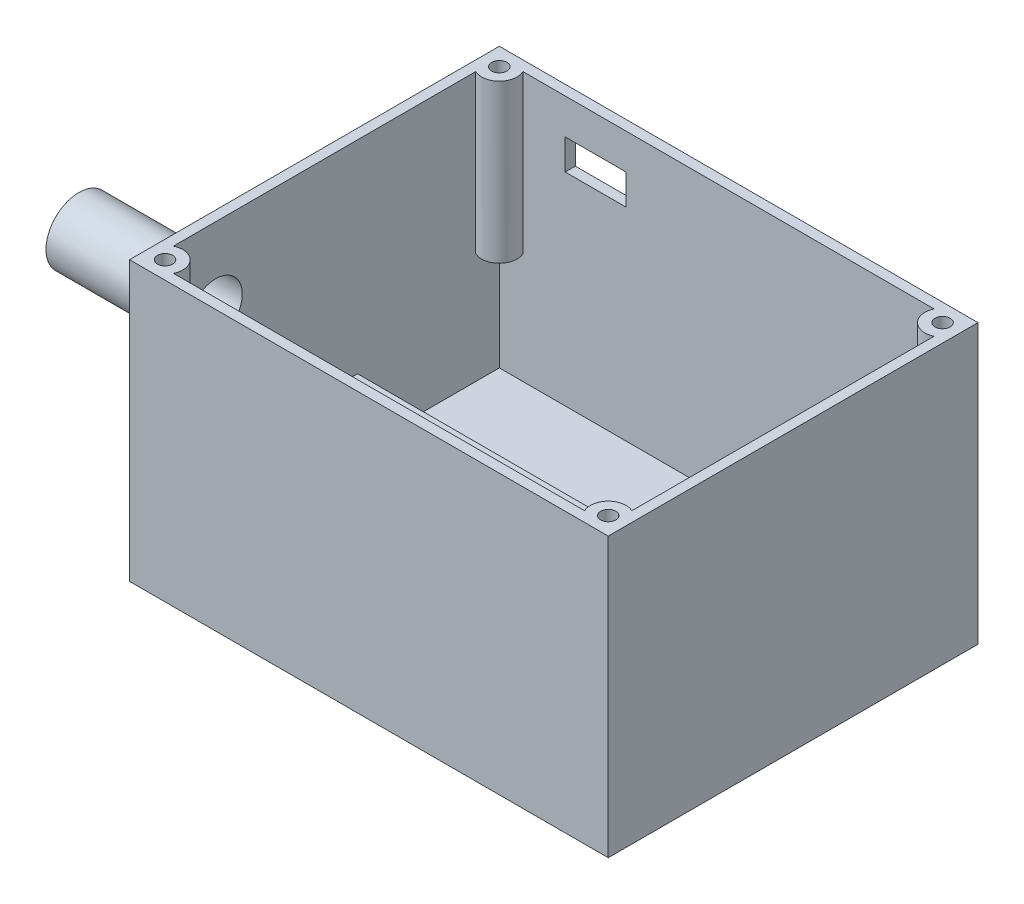
from build123d import *

# Parameters (mm, degrees)
SKETCH1_W                 = 94.5
SKETCH1_H                 = 73
BOSS_EXTRUDE1_DEPTH       = 55
F_3_0MM_DOWEL_HOLE1_D     = 3
F_3_0MM_DOWEL_HOLE1_DEPTH = 30
F_3_0MM_DOWEL_HOLE1_TIP   = 0.901290929
SKETCH7_W                 = 60
SKETCH7_H                 = 31
CUT_EXTRUDE2_DEPTH        = 20
SHELL2_START              = 2
SHELL2_DEPTH              = 53
SHELL2_START_2            = 22
SHELL2_2_OUTLINE_W        = 64
SHELL2_2_OUTLINE_H        = 34
SHELL2_2_DEPTH            = 33
SHELL2_3_DEPTH            = 21.868454444
CUT_EXTRUDE3_DEPTH        = 1.5
F_3_0MM_DOWEL_HOLE3_D     = 3
SKETCH15_R                = 3.5
CUT_EXTRUDE4_DEPTH        = 3
SKETCH20_W                = 78.95760637
SKETCH20_H                = 8
BOSS_EXTRUDE2_DEPTH       = 10
SKETCH21_W                = 6
SKETCH21_H                = 6
BOSS_EXTRUDE3_DEPTH       = 30
F_3_0MM_DOWEL_HOLE5_D     = 3
F_3_0MM_DOWEL_HOLE5_DEPTH = 10
F_3_0MM_DOWEL_HOLE5_TIP   = 0.901290929
F_3_0MM_DOWEL_HOLE6_D     = 3
F_3_0MM_DOWEL_HOLE6_DEPTH = 10
F_3_0MM_DOWEL_HOLE6_TIP   = 0.901290929
SKETCH27_W                = 12
SKETCH27_H                = 6
CUT_EXTRUDE5_DEPTH        = 30
SKETCH28_R                = 6.5
BOSS_EXTRUDE4_DEPTH       = 25
FILLET1_R                 = 6
SKETCH29_R                = 5.25
CUT_EXTRUDE6_DEPTH        = 29


with BuildPart() as part:
    # Sketch1 → Boss-Extrude1 (new body)
    with BuildSketch(Plane(origin=(0, 0, 0), x_dir=(1, 0, 0), z_dir=(0, 1, 0))):
        Rectangle(SKETCH1_W, SKETCH1_H)
    extrude(amount=BOSS_EXTRUDE1_DEPTH)

    # Ø3.0mm Dowel Hole1
    with Locations(Plane(origin=(-43.75, 55, -33), x_dir=(0, 0, 1), z_dir=(0, 1, 0))):
        with Locations((0, 0), (0, 87.5), (66, 87.5), (66, 0)):
            Hole(F_3_0MM_DOWEL_HOLE1_D / 2, depth=F_3_0MM_DOWEL_HOLE1_DEPTH)
            with Locations((0, 0, -(F_3_0MM_DOWEL_HOLE1_DEPTH + F_3_0MM_DOWEL_HOLE1_TIP / 2))):  # 118° drill point
                Cone(0, F_3_0MM_DOWEL_HOLE1_D / 2, F_3_0MM_DOWEL_HOLE1_TIP, mode=Mode.SUBTRACT)

    # Sketch7 → Cut-Extrude2 (cut)
    with BuildSketch(Plane.XZ):
        with Locations((-6.25, 18)):
            Rectangle(SKETCH7_W, SKETCH7_H)
    extrude(amount=-CUT_EXTRUDE2_DEPTH, mode=Mode.SUBTRACT)

    # Shell2: read off the stored shape, not the designer's step
    # Shell2 outline → Shell2 (cut)
    with BuildSketch(Plane(origin=(0, 0, 0), x_dir=(1, 0, 0), z_dir=(0, 1, 0)).offset(SHELL2_START)):
        with BuildLine():
            Line((-45.25, 29.83772234), (-45.25, -29.83772234))
            ThreePointArc((-45.25, -29.83772234), (-41.275126266, -30.525126266), (-40.58772234, -34.5))
            Line((-40.58772234, -34.5), (-38.25, -34.5))
            Line((-38.25, -34.5), (-38.25, -0.5))
            Line((-38.25, -0.5), (25.75, -0.5))
            Line((25.75, -0.5), (25.75, -34.5))
            Line((25.75, -34.5), (40.58772234, -34.5))
            ThreePointArc((40.58772234, -34.5), (41.275126266, -30.525126266), (45.25, -29.83772234))
            Line((45.25, -29.83772234), (45.25, 29.83772234))
            ThreePointArc((45.25, 29.83772234), (41.275126266, 30.525126266), (40.58772234, 34.5))
            Line((40.58772234, 34.5), (-40.58772234, 34.5))
            ThreePointArc((-40.58772234, 34.5), (-41.275126266, 30.525126266), (-45.25, 29.83772234))
        make_face()
    extrude(amount=SHELL2_DEPTH, mode=Mode.SUBTRACT)

    # Shell2 2 outline → Shell2 2 (cut)
    with BuildSketch(Plane(origin=(0, 0, 0), x_dir=(1, 0, 0), z_dir=(0, 1, 0)).offset(SHELL2_START_2)):
        with Locations((-6.25, -17.5)):
            Rectangle(SHELL2_2_OUTLINE_W, SHELL2_2_OUTLINE_H)
    extrude(amount=SHELL2_2_DEPTH, mode=Mode.SUBTRACT)

    # Shell2 3 outline → Shell2 3 (cut)
    with BuildSketch(Plane(origin=(0, 0, 0), x_dir=(1, 0, 0), z_dir=(0, 1, 0)).offset(SHELL2_START)):
        with BuildLine():
            Line((-45.25, -29.83772234), (-45.25, -34.5))
            Line((-45.25, -34.5), (-40.58772234, -34.5))
            ThreePointArc((-40.58772234, -34.5), (-41.275126266, -30.525126266), (-45.25, -29.83772234))
        make_face()
        with BuildLine():
            Line((-45.25, 34.5), (-45.25, 29.83772234))
            ThreePointArc((-45.25, 29.83772234), (-41.275126266, 30.525126266), (-40.58772234, 34.5))
            Line((-40.58772234, 34.5), (-45.25, 34.5))
        make_face()
        with BuildLine():
            Line((45.25, 34.5), (40.58772234, 34.5))
            ThreePointArc((40.58772234, 34.5), (41.275126266, 30.525126266), (45.25, 29.83772234))
            Line((45.25, 29.83772234), (45.25, 34.5))
        make_face()
        with BuildLine():
            ThreePointArc((45.25, -29.83772234), (41.275126266, -30.525126266), (40.58772234, -34.5))
            Line((40.58772234, -34.5), (45.25, -34.5))
            Line((45.25, -34.5), (45.25, -29.83772234))
        make_face()
    extrude(amount=SHELL2_3_DEPTH, mode=Mode.SUBTRACT)

    # Shell2 4 outline → Shell2 4 (revolve)
    with BuildSketch(Plane(origin=(-43.75, 0, 33), x_dir=(1, 0, 0), z_dir=(0, 0, 1))):
        Polygon((0, 23.868454444), (0, 21.765442277), (3.5, 23.868454444), align=None)
    revolve(axis=Axis((-43.75, 0, 33), (0, 1, 0)))

    # Shell2 5 outline → Shell2 5 (revolve)
    with BuildSketch(Plane(origin=(43.75, 0, 33), x_dir=(1, 0, 0), z_dir=(0, 0, 1))):
        Polygon((0, 23.868454444), (0, 21.765442277), (3.5, 23.868454444), align=None)
    revolve(axis=Axis((43.75, 0, 33), (0, 1, 0)))

    # Shell2 6 outline → Shell2 6 (revolve)
    with BuildSketch(Plane(origin=(43.75, 0, -33), x_dir=(1, 0, 0), z_dir=(0, 0, 1))):
        Polygon((0, 23.868454444), (0, 21.765442277), (3.5, 23.868454444), align=None)
    revolve(axis=Axis((43.75, 0, -33), (0, 1, 0)))

    # Shell2 7 outline → Shell2 7 (revolve)
    with BuildSketch(Plane(origin=(-43.75, 0, -33), x_dir=(1, 0, 0), z_dir=(0, 0, 1))):
        Polygon((0, 23.868454444), (0, 21.765442277), (3.5, 23.868454444), align=None)
    revolve(axis=Axis((-43.75, 0, -33), (0, 1, 0)))

    # Sketch8 → Cut-Extrude3 (cut)
    with BuildSketch(Plane.XZ):
        with BuildLine():
            Line((23.75, 25), (23.75, 11))
            ThreePointArc((23.75, 11), (30.75, 18), (23.75, 25))
        make_face()
        with BuildLine():
            ThreePointArc((-36.25, 25), (-43.25, 18), (-36.25, 11))
            Line((-36.25, 11), (-36.25, 25))
        make_face()
    extrude(amount=-CUT_EXTRUDE3_DEPTH, mode=Mode.SUBTRACT)

    # Ø3.0mm Dowel Hole3 (through all)
    with Locations(Plane(origin=(27.45, 1.5, 18), x_dir=(0, 0, -1), z_dir=(0, -1, 0))):
        with Locations((0, 0), (0, -67.4)):
            Hole(F_3_0MM_DOWEL_HOLE3_D / 2)

    # Sketch15 → Cut-Extrude4 (cut)
    with BuildSketch(Plane.ZY.offset(-23.75)):
        with Locations((15.383017002, 11.670955046)):
            Circle(SKETCH15_R)
    extrude(amount=-CUT_EXTRUDE4_DEPTH, mode=Mode.SUBTRACT)

    # Sketch20 → Boss-Extrude2 (add)
    with BuildSketch(Plane(origin=(0, 22, 0), x_dir=(1, 0, 0), z_dir=(0, 1, 0))):
        with Locations((0.166869447, -30.5)):
            Rectangle(SKETCH20_W, SKETCH20_H)
    extrude(amount=BOSS_EXTRUDE2_DEPTH)

    # Sketch21 → Boss-Extrude3 (add)
    with BuildSketch(Plane(origin=(0, 2, 0), x_dir=(1, 0, 0), z_dir=(0, 1, 0))):
        with Locations((38.75, 26.5)):
            Rectangle(SKETCH21_W, SKETCH21_H)
    extrude(amount=BOSS_EXTRUDE3_DEPTH)

    # Ø3.0mm Dowel Hole5
    with Locations(Plane(origin=(0, 32, 0), x_dir=(1, 0, 0), z_dir=(0, 1, 0))):
        with Locations((36.25, -32), (-35.935310091, -32.352990413)):
            Hole(F_3_0MM_DOWEL_HOLE5_D / 2, depth=F_3_0MM_DOWEL_HOLE5_DEPTH)
            with Locations((0, 0, -(F_3_0MM_DOWEL_HOLE5_DEPTH + F_3_0MM_DOWEL_HOLE5_TIP / 2))):  # 118° drill point
                Cone(0, F_3_0MM_DOWEL_HOLE5_D / 2, F_3_0MM_DOWEL_HOLE5_TIP, mode=Mode.SUBTRACT)

    # Ø3.0mm Dowel Hole6
    with Locations(Plane(origin=(0, 32, 0), x_dir=(1, 0, 0), z_dir=(0, 1, 0))):
        with Locations((38.75, 26.5)):
            Hole(F_3_0MM_DOWEL_HOLE6_D / 2, depth=F_3_0MM_DOWEL_HOLE6_DEPTH)
            with Locations((0, 0, -(F_3_0MM_DOWEL_HOLE6_DEPTH + F_3_0MM_DOWEL_HOLE6_TIP / 2))):  # 118° drill point
                Cone(0, F_3_0MM_DOWEL_HOLE6_D / 2, F_3_0MM_DOWEL_HOLE6_TIP, mode=Mode.SUBTRACT)

    # Sketch27 → Cut-Extrude5 (cut)
    with BuildSketch(Plane(origin=(0, 0, -36.5), x_dir=(-1, 0, 0), z_dir=(0, 0, -1))):
        with Locations((26.25, 45)):
            Rectangle(SKETCH27_W, SKETCH27_H)
    extrude(amount=-CUT_EXTRUDE5_DEPTH, mode=Mode.SUBTRACT)

    # Sketch28 → Boss-Extrude4 (add)
    with BuildSketch(Plane.ZY.offset(47.25)):
        with Locations(Location((21.5, 40, 0), (0, 0, 180))):
            Circle(SKETCH28_R)
    extrude(amount=BOSS_EXTRUDE4_DEPTH)

    # Fillet1
    fillet1_edges = [part.edges().sort_by_distance(p)[0] for p in [
        (-47.25, 40, 28),
    ]]
    fillet(fillet1_edges, radius=FILLET1_R)

    # Sketch29 → Cut-Extrude6 (cut)
    with BuildSketch(Plane.ZY.offset(72.25)):
        with Locations((21.5, 40)):
            Circle(SKETCH29_R)
    extrude(amount=-CUT_EXTRUDE6_DEPTH, mode=Mode.SUBTRACT)


solid = part.part
